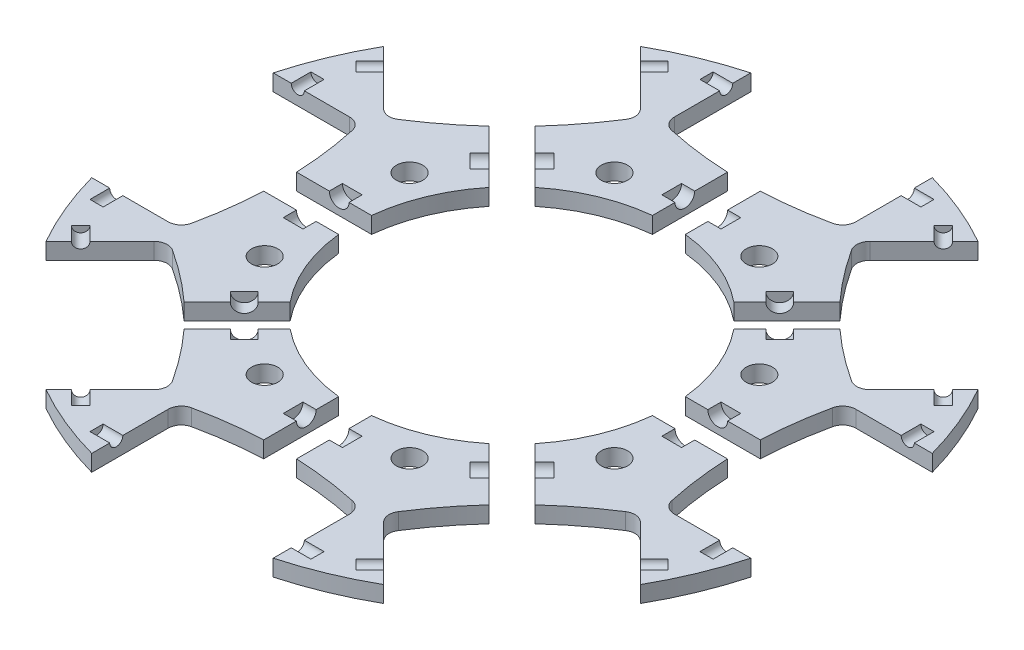
from build123d import *

# Parameters (mm, degrees)
SKETCH1_R                = 82.55
BOSS_EXTRUDE1_DEPTH      = 3.96875
CUT_EXTRUDE1_DEPTH       = 117.810769951
FILLET1_R                = 3.175
CUT_EXTRUDE9_DEPTH       = 117.810769951
CIRPATTERN1_START        = -3.96875
CIRPATTERN1_DEPTH        = 7.9375
SKETCH3_R                = 1.5875
CUT_EXTRUDE2_DEPTH       = 26.6827
CIRPATTERN3_COUNT        = 8
SKETCH5_R                = 82.55
CUT_EXTRUDE3_DEPTH       = 113.622504475
SKETCH7_W                = 7.9375
SKETCH7_H                = 64.727921402
CUT_EXTRUDE4_DEPTH       = 113.622504475
SKETCH9_R                = 2.38125
CUT_EXTRUDE6_DEPTH       = 7.14375
CIRPATTERN4_COUNT        = 8
CUT_EXTRUDE5_DEPTH       = 113.622504475
CUT_EXTRUDE5_DEPTH_BACK  = 113.622504475
SKETCH8_R                = 38.1
CUT_EXTRUDE11_DEPTH      = 113.622504475
CUT_EXTRUDE11_DEPTH_BACK = 113.622504475
SKETCH17_R               = 3.175


# Read off the part's stored shape, not the designer's step: CirPattern1
with BuildPart() as part:
    # Sketch1 → Boss-Extrude1 (new, symmetric)
    with BuildSketch(Plane(origin=(0, 0, 0), x_dir=(1, 0, 0), z_dir=(0, 1, 0))):
        with Locations(Location((0, 0, 0), (0, 0, 270))):
            Circle(SKETCH1_R)
    extrude(amount=BOSS_EXTRUDE1_DEPTH, both=True)

    # Sketch2 → Cut-Extrude1 (cut, symmetric)
    with BuildSketch(Plane(origin=(0, 0, 0), x_dir=(1, 0, 0), z_dir=(0, 1, 0))):
        with BuildLine():
            Line((-21.919482915, 86.15536123), (-21.919482915, 61.16463877))
            ThreePointArc((-21.919482915, 61.16463877), (0, 58.42), (21.919482915, 61.16463877))
            Line((21.919482915, 61.16463877), (21.919482915, 86.15536123))
            ThreePointArc((21.919482915, 86.15536123), (0, 88.9), (-21.919482915, 86.15536123))
        make_face()
    extrude(amount=CUT_EXTRUDE1_DEPTH, both=True, mode=Mode.SUBTRACT)

    # Fillet1
    fillet1_edges = [part.edges().sort_by_distance(p)[0] for p in [
        (-21.919482915, 0, -61.16463877),
        (21.919482915, 0, -61.16463877),
    ]]
    fillet(fillet1_edges, radius=FILLET1_R)

    # Sketch16 → Cut-Extrude9 (cut, symmetric)
    with BuildSketch(Plane(origin=(0, 0, 0), x_dir=(1, 0, 0), z_dir=(0, 1, 0))):
        with BuildLine():
            Line((-21.919482915, 63.669417305), (-21.919482915, 61.11136806))
            ThreePointArc((-21.919482915, 61.11136806), (-21.21656987, 59.119029965), (-19.419066484, 58.008859074))
            ThreePointArc((-19.419066484, 58.008859074), (0, 55.922078598), (19.419066484, 58.008859074))
            ThreePointArc((19.419066484, 58.008859074), (21.21656987, 59.119029965), (21.919482915, 61.11136806))
            Line((21.919482915, 61.11136806), (21.919482915, 63.669417305))
            ThreePointArc((21.919482915, 63.669417305), (21.222873253, 61.684925851), (19.438723023, 60.571247575))
            ThreePointArc((19.438723023, 60.571247575), (0, 58.42), (-19.438723023, 60.571247575))
            ThreePointArc((-19.438723023, 60.571247575), (-21.222873253, 61.684925851), (-21.919482915, 63.669417305))
        make_face()
    extrude(amount=CUT_EXTRUDE9_DEPTH, both=True, mode=Mode.SUBTRACT)

    # CirPattern1 outline → CirPattern1 (cut)
    with BuildSketch(Plane(origin=(0, 0, 0), x_dir=(1, 0, 0), z_dir=(0, 1, 0)).offset(CIRPATTERN1_START)):
        with BuildLine():
            ThreePointArc((-21.919482915, -79.586674568), (0, -82.55), (21.919482915, -79.586674568))
            Line((21.919482915, -79.586674568), (21.919482915, -61.11136806))
            ThreePointArc((21.919482915, -61.11136806), (21.21656987, -59.119029965), (19.419066484, -58.008859074))
            ThreePointArc((19.419066484, -58.008859074), (0, -55.922078598), (-19.419066484, -58.008859074))
            ThreePointArc((-19.419066484, -58.008859074), (-21.21656987, -59.119029965), (-21.919482915, -61.11136806))
            Line((-21.919482915, -61.11136806), (-21.919482915, -79.586674568))
        make_face()
        with BuildLine():
            Line((58.711677771, 27.712847753), (71.775692288, 40.77686227))
            ThreePointArc((71.775692288, 40.77686227), (58.371664787, 58.371664787), (40.77686227, 71.775692288))
            Line((40.77686227, 71.775692288), (27.712847753, 58.711677771))
            ThreePointArc((27.712847753, 58.711677771), (26.801086557, 56.805847414), (27.287104024, 54.749811215))
            ThreePointArc((27.287104024, 54.749811215), (39.542880994, 39.542880994), (54.749811215, 27.287104024))
            ThreePointArc((54.749811215, 27.287104024), (56.805847414, 26.801086557), (58.711677771, 27.712847753))
        make_face()
        with BuildLine():
            Line((61.11136806, -21.919482915), (79.586674568, -21.919482915))
            ThreePointArc((79.586674568, -21.919482915), (82.55, 0), (79.586674568, 21.919482915))
            Line((79.586674568, 21.919482915), (61.11136806, 21.919482915))
            ThreePointArc((61.11136806, 21.919482915), (59.119029965, 21.21656987), (58.008859074, 19.419066484))
            ThreePointArc((58.008859074, 19.419066484), (55.922078598, 0), (58.008859074, -19.419066484))
            ThreePointArc((58.008859074, -19.419066484), (59.119029965, -21.21656987), (61.11136806, -21.919482915))
        make_face()
        with BuildLine():
            Line((27.712847753, -58.711677771), (40.77686227, -71.775692288))
            ThreePointArc((40.77686227, -71.775692288), (58.371664787, -58.371664787), (71.775692288, -40.77686227))
            Line((71.775692288, -40.77686227), (58.711677771, -27.712847753))
            ThreePointArc((58.711677771, -27.712847753), (56.805847414, -26.801086557), (54.749811215, -27.287104024))
            ThreePointArc((54.749811215, -27.287104024), (39.542880994, -39.542880994), (27.287104024, -54.749811215))
            ThreePointArc((27.287104024, -54.749811215), (26.801086557, -56.805847414), (27.712847753, -58.711677771))
        make_face()
        with BuildLine():
            ThreePointArc((-40.77686227, 71.775692288), (-58.371664787, 58.371664787), (-71.775692288, 40.77686227))
            Line((-71.775692288, 40.77686227), (-58.711677771, 27.712847753))
            ThreePointArc((-58.711677771, 27.712847753), (-56.805847414, 26.801086557), (-54.749811215, 27.287104024))
            ThreePointArc((-54.749811215, 27.287104024), (-39.542880994, 39.542880994), (-27.287104024, 54.749811215))
            ThreePointArc((-27.287104024, 54.749811215), (-26.801086557, 56.805847414), (-27.712847753, 58.711677771))
            Line((-27.712847753, 58.711677771), (-40.77686227, 71.775692288))
        make_face()
        with BuildLine():
            ThreePointArc((-79.586674568, 21.919482915), (-82.55, 0), (-79.586674568, -21.919482915))
            Line((-79.586674568, -21.919482915), (-61.11136806, -21.919482915))
            ThreePointArc((-61.11136806, -21.919482915), (-59.119029965, -21.21656987), (-58.008859074, -19.419066484))
            ThreePointArc((-58.008859074, -19.419066484), (-55.922078598, 0), (-58.008859074, 19.419066484))
            ThreePointArc((-58.008859074, 19.419066484), (-59.119029965, 21.21656987), (-61.11136806, 21.919482915))
            Line((-61.11136806, 21.919482915), (-79.586674568, 21.919482915))
        make_face()
        with BuildLine():
            ThreePointArc((-71.775692288, -40.77686227), (-58.371664787, -58.371664787), (-40.77686227, -71.775692288))
            Line((-40.77686227, -71.775692288), (-27.712847753, -58.711677771))
            ThreePointArc((-27.712847753, -58.711677771), (-26.801086557, -56.805847414), (-27.287104024, -54.749811215))
            ThreePointArc((-27.287104024, -54.749811215), (-39.542880994, -39.542880994), (-54.749811215, -27.287104024))
            ThreePointArc((-54.749811215, -27.287104024), (-56.805847414, -26.801086557), (-58.711677771, -27.712847753))
            Line((-58.711677771, -27.712847753), (-71.775692288, -40.77686227))
        make_face()
    extrude(amount=CIRPATTERN1_DEPTH, mode=Mode.SUBTRACT)

    # Sketch3 → Cut-Extrude2 (cut, symmetric)
    with BuildSketch(Plane(origin=(0, 0, 0), x_dir=(0, 0, -1), z_dir=(1, 0, 0))):
        with Locations((73.66, 0)):
            Circle(SKETCH3_R)
    cut_extrude2 = extrude(amount=CUT_EXTRUDE2_DEPTH, both=True, mode=Mode.SUBTRACT)

    # CirPattern3: Cut-Extrude2 ×8 about axis
    cirpattern3_axis = Axis((0, 0, 0), (0, 1, 0))
    for i in range(1, CIRPATTERN3_COUNT):
        add(cut_extrude2.rotate(cirpattern3_axis, i * 360 / CIRPATTERN3_COUNT), mode=Mode.SUBTRACT)

    # Sketch5 → Cut-Extrude3 (cut, through all)
    with BuildSketch(Plane(origin=(0, 0, 0), x_dir=(1, 0, 0), z_dir=(0, 1, 0))):
        Circle(SKETCH5_R)
    extrude(amount=CUT_EXTRUDE3_DEPTH, mode=Mode.SUBTRACT)

    # Sketch7 → Cut-Extrude4 (cut, symmetric)
    with BuildSketch(Plane(origin=(0, 0, 0), x_dir=(1, 0, 0), z_dir=(0, 1, 0))):
        with Locations((0, 56.536039299)):
            Rectangle(SKETCH7_W, SKETCH7_H)
    cut_extrude4 = extrude(amount=CUT_EXTRUDE4_DEPTH, both=True, mode=Mode.SUBTRACT)

    # Sketch9 → Cut-Extrude6 (cut, symmetric)
    with BuildSketch(Plane(origin=(0, 0, 0), x_dir=(0, 0, -1), z_dir=(1, 0, 0))):
        with Locations((45.72, 0)):
            Circle(SKETCH9_R)
    cut_extrude6 = extrude(amount=CUT_EXTRUDE6_DEPTH, both=True, mode=Mode.SUBTRACT)

    # CirPattern4: Cut-Extrude4, Cut-Extrude6 ×8 about axis
    cirpattern4_axis = Axis((0, 0, 0), (0, 1, 0))
    add([cut_extrude4.rotate(cirpattern4_axis, i * 360 / CIRPATTERN4_COUNT) for i in range(1, CIRPATTERN4_COUNT)], mode=Mode.SUBTRACT)
    add([cut_extrude6.rotate(cirpattern4_axis, i * 360 / CIRPATTERN4_COUNT) for i in range(1, CIRPATTERN4_COUNT)], mode=Mode.SUBTRACT)

    # Sketch8 → Cut-Extrude5 (cut, two sides: drawn at the far end of the back side and taken through both)
    with BuildSketch(Plane(origin=(0, 0, 0), x_dir=(1, 0, 0), z_dir=(0, 1, 0)).offset(-CUT_EXTRUDE5_DEPTH_BACK)):
        Circle(SKETCH8_R)
    extrude(amount=CUT_EXTRUDE5_DEPTH + CUT_EXTRUDE5_DEPTH_BACK, mode=Mode.SUBTRACT)


with BuildPart() as cut_extrude5_piece_1:
    # of the separate pieces the step leaves, piece 1, a body of its own (cut_extrude5_pieces)
    add(part.part.solids().sort_by_distance((-3.96875, 0, 43.33875))[0])


with BuildPart() as cut_extrude5_piece_2:
    # of the separate pieces the step leaves, piece 2, a body of its own (cut_extrude5_pieces)
    add(part.part.solids().sort_by_distance((43.33875, 0, 3.96875))[0])


with BuildPart() as cut_extrude5_piece_3:
    # of the separate pieces the step leaves, piece 3, a body of its own (cut_extrude5_pieces)
    add(part.part.solids().sort_by_distance((79.586674568, 0, -21.919482915))[0])


with BuildPart() as cut_extrude5_piece_4:
    # of the separate pieces the step leaves, piece 4, a body of its own (cut_extrude5_pieces)
    add(part.part.solids().sort_by_distance((-33.451454051, 0, 27.838793975))[0])


with BuildPart() as cut_extrude5_piece_5:
    # of the separate pieces the step leaves, piece 5, a body of its own (cut_extrude5_pieces)
    add(part.part.solids().sort_by_distance((-29.60053672, 0, -23.987876644))[0])


with BuildPart() as cut_extrude5_piece_6:
    # of the separate pieces the step leaves, piece 6, a body of its own (cut_extrude5_pieces)
    add(part.part.solids().sort_by_distance((21.919482915, 0, -72.0725))[0])


with BuildPart() as cut_extrude5_piece_7:
    # of the separate pieces the step leaves, piece 7, a body of its own (cut_extrude5_pieces)
    add(part.part.solids().sort_by_distance((27.838793975, 0, 33.451454051))[0])


with BuildPart() as cut_extrude5_piece_8:
    # of the separate pieces the step leaves, piece 8, a body of its own (cut_extrude5_pieces)
    add(part.part.solids().sort_by_distance((-3.96875, 0, -37.892730483))[0])


with BuildPart() as cut_extrude11_tool:
    # Sketch17 → Cut-Extrude11 (new, two sides: drawn at the far end of the back side and taken through both)
    with BuildSketch(Plane(origin=(0, 0, 0), x_dir=(1, 0, 0), z_dir=(0, 1, 0)).offset(-CUT_EXTRUDE11_DEPTH_BACK)):
        with Locations(Location((-17.496286528, 42.239772226, 0), (0, 0, 270))):
            Circle(SKETCH17_R)
        with Locations(Location((17.496286528, 42.239772226, 0), (0, 0, 270))):
            Circle(SKETCH17_R)
        with Locations(Location((42.239772226, 17.496286528, 0), (0, 0, 270))):
            Circle(SKETCH17_R)
        with Locations(Location((42.239772226, -17.496286528, 0), (0, 0, 270))):
            Circle(SKETCH17_R)
        with Locations(Location((17.496286528, -42.239772226, 0), (0, 0, 270))):
            Circle(SKETCH17_R)
        with Locations(Location((-17.496286528, -42.239772226, 0), (0, 0, 270))):
            Circle(SKETCH17_R)
        with Locations(Location((-42.239772226, -17.496286528, 0), (0, 0, 270))):
            Circle(SKETCH17_R)
        with Locations(Location((-42.239772226, 17.496286528, 0), (0, 0, 270))):
            Circle(SKETCH17_R)
    extrude(amount=CUT_EXTRUDE11_DEPTH + CUT_EXTRUDE11_DEPTH_BACK)


with BuildPart() as cut_extrude5_piece_1_1:
    add(cut_extrude5_piece_1.part)

    # Cut-Extrude11: cut by cut_extrude11_tool
    add(cut_extrude11_tool.part, mode=Mode.SUBTRACT)


with BuildPart() as cut_extrude5_piece_2_1:
    add(cut_extrude5_piece_2.part)

    # Cut-Extrude11: cut by cut_extrude11_tool
    add(cut_extrude11_tool.part, mode=Mode.SUBTRACT)


with BuildPart() as cut_extrude5_piece_3_1:
    add(cut_extrude5_piece_3.part)

    # Cut-Extrude11: cut by cut_extrude11_tool
    add(cut_extrude11_tool.part, mode=Mode.SUBTRACT)


with BuildPart() as cut_extrude5_piece_4_1:
    add(cut_extrude5_piece_4.part)

    # Cut-Extrude11: cut by cut_extrude11_tool
    add(cut_extrude11_tool.part, mode=Mode.SUBTRACT)


with BuildPart() as cut_extrude5_piece_5_1:
    add(cut_extrude5_piece_5.part)

    # Cut-Extrude11: cut by cut_extrude11_tool
    add(cut_extrude11_tool.part, mode=Mode.SUBTRACT)


with BuildPart() as cut_extrude5_piece_6_1:
    add(cut_extrude5_piece_6.part)

    # Cut-Extrude11: cut by cut_extrude11_tool
    add(cut_extrude11_tool.part, mode=Mode.SUBTRACT)


with BuildPart() as cut_extrude5_piece_7_1:
    add(cut_extrude5_piece_7.part)

    # Cut-Extrude11: cut by cut_extrude11_tool
    add(cut_extrude11_tool.part, mode=Mode.SUBTRACT)


with BuildPart() as cut_extrude5_piece_8_1:
    add(cut_extrude5_piece_8.part)

    # Cut-Extrude11: cut by cut_extrude11_tool
    add(cut_extrude11_tool.part, mode=Mode.SUBTRACT)


solid = Compound([cut_extrude5_piece_1_1.part, cut_extrude5_piece_2_1.part, cut_extrude5_piece_3_1.part, cut_extrude5_piece_4_1.part, cut_extrude5_piece_5_1.part, cut_extrude5_piece_6_1.part, cut_extrude5_piece_7_1.part, cut_extrude5_piece_8_1.part])
